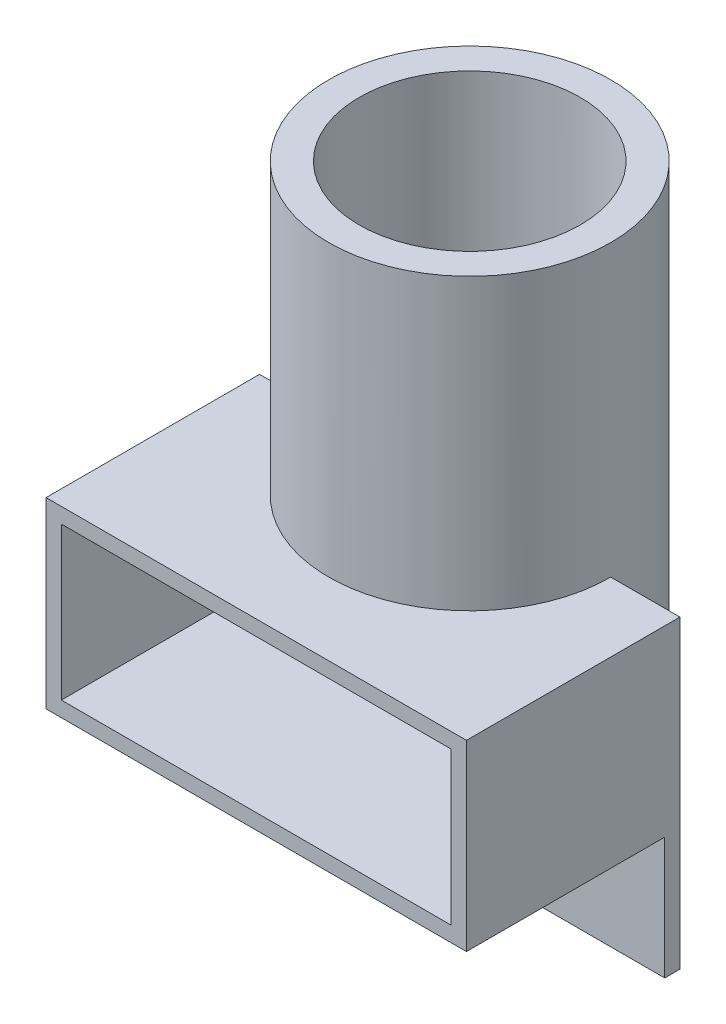
from build123d import *
from build123d.topology import SkipClean

# Parameters (mm, degrees)
SKETCH_2_R          = 9.25
SKETCH_2_R_2        = 7.25
F_19MM_DEPTH        = 19
EXTRUDE_START       = -11
EXTRUDE_7_DEPTH     = 11
SKETCH_630_W        = 27.57
SKETCH_630_H        = 12
EXTRUDE_682_DEPTH   = 14
SKETCH_6_W          = 25.57
SKETCH_6_H          = 10
CUT_EXTRUDE_1_DEPTH = 12
FILLET_1_R          = 5
SKETCH_10_W         = 27.57
SKETCH_10_H         = 1
EXTRUDE_3_DEPTH     = 8


with BuildPart() as part:
    # 草圖2 → 19mm (new body)
    with BuildSketch(Plane(origin=(0, 0, 0), x_dir=(1, 0, 0), z_dir=(0, 1, 0))):
        Circle(SKETCH_2_R)
        Circle(SKETCH_2_R_2, mode=Mode.SUBTRACT)
    extrude(amount=F_19MM_DEPTH)

    # 草圖14 → 伸長-薄件7 (add)
    with SkipClean():  # the faces are left unmerged after this step: merging them gives an invalid solid
        with BuildSketch(Plane(origin=(0, 0, 0), x_dir=(1, 0, 0), z_dir=(0, 1, 0)).offset(EXTRUDE_START)):
            with BuildLine():
                ThreePointArc((7.25, 0), (0, 7.25), (-7.25, 0))
                Line((-7.25, 0), (-9.25, 0))
                ThreePointArc((-9.25, 0), (0, 9.25), (9.25, 0))
                Line((9.25, 0), (7.25, 0))
            make_face()
        extrude(amount=EXTRUDE_7_DEPTH)

    # Sketch 630 → Extrude 682 (add)
    with SkipClean():  # the faces are left unmerged after this step: merging them gives an invalid solid
        with BuildSketch(Plane.XY):
            with Locations((0, -6)):
                Rectangle(SKETCH_630_W, SKETCH_630_H)
        extrude(amount=EXTRUDE_682_DEPTH)

    # 草圖6 → 除料-伸長1 (cut)
    with SkipClean():  # the faces are left unmerged after this step: merging them gives an invalid solid
        with BuildSketch(Plane.XY.offset(14)):
            with Locations((0, -6)):
                Rectangle(SKETCH_6_W, SKETCH_6_H)
        extrude(amount=-CUT_EXTRUDE_1_DEPTH, mode=Mode.SUBTRACT)

    # 圓角1
    # the kernel refuses this fillet: 5 mm, written as the material it takes off along each edge
    with BuildSketch(Plane(origin=(-19.75, 0, 0), x_dir=(0, -1, 0), z_dir=(1, 0, 0))) as fillet_1_piece_1_section:
        with BuildLine():
            CenterArc((FILLET_1_R, -FILLET_1_R), FILLET_1_R, 90, 90)
            Line((0, -FILLET_1_R), (0, 0))
            Line((0, 0), (FILLET_1_R, 0))
        make_face()
    fillet_1_piece_1 = extrude(amount=39.5, mode=Mode.PRIVATE)
    fillet_1_piece_1 = fillet_1_piece_1 & Plane(origin=(0, -1.958227167, 0), x_dir=(1, 0, 0), z_dir=(0, -1, 0)) * Cylinder(7.25, 99, mode=Mode.PRIVATE)
    add(fillet_1_piece_1, mode=Mode.SUBTRACT)

    # 草圖10 → 填料-伸長3 (add)
    with BuildSketch(Plane.XZ.offset(12)):
        with Locations((0, 0.5)):
            Rectangle(SKETCH_10_W, SKETCH_10_H)
    extrude(amount=EXTRUDE_3_DEPTH)


solid = part.part
